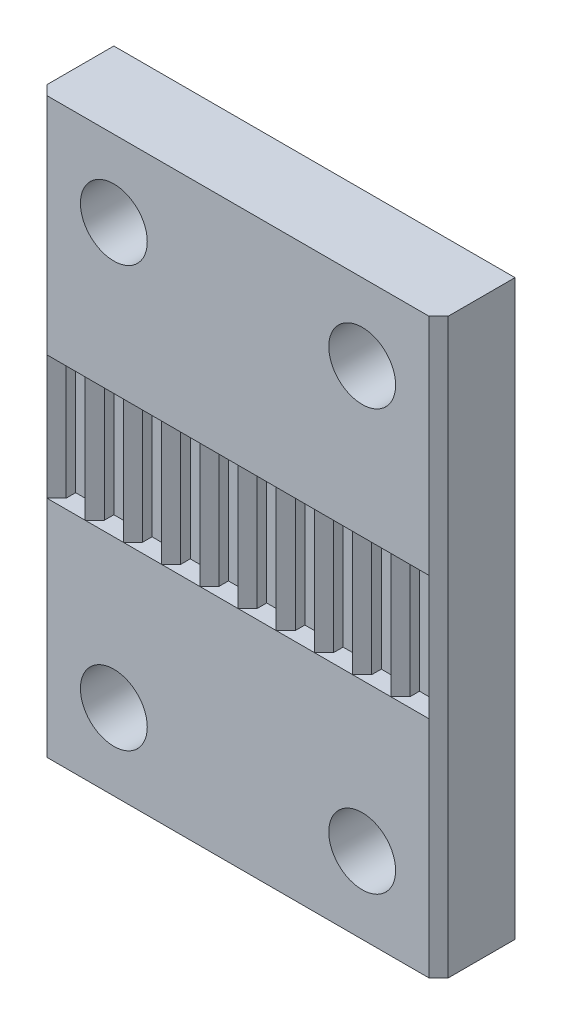
from build123d import *

# Parameters (mm, degrees)
SKETCH1_W           = 21
SKETCH1_H           = 30
SKETCH1_R           = 1.75
BOSS_EXTRUDE1_DEPTH = 4
SKETCH2_W           = 21
SKETCH2_H           = 6.5
CUT_EXTRUDE1_DEPTH  = 1
SKETCH3_W           = 1
SKETCH3_H           = 6.5
BOSS_EXTRUDE2_DEPTH = 1
CHAMFER1_SIZE       = 0.5
CHAMFER2_SIZE       = 0.5


with BuildPart() as part:
    # Sketch1 → Boss-Extrude1 (new body)
    with BuildSketch(Plane.XY):
        with Locations((10.5, 15)):
            Rectangle(SKETCH1_W, SKETCH1_H)
        with Locations((4, 4)):
            Circle(SKETCH1_R, mode=Mode.SUBTRACT)
        with Locations((17, 4)):
            Circle(SKETCH1_R, mode=Mode.SUBTRACT)
        with Locations((17, 26)):
            Circle(SKETCH1_R, mode=Mode.SUBTRACT)
        with Locations((4, 26)):
            Circle(SKETCH1_R, mode=Mode.SUBTRACT)
    extrude(amount=BOSS_EXTRUDE1_DEPTH)

    # Sketch2 → Cut-Extrude1 (cut)
    with BuildSketch(Plane.XY.offset(4)):
        with Locations((10.5, 15)):
            Rectangle(SKETCH2_W, SKETCH2_H)
    extrude(amount=-CUT_EXTRUDE1_DEPTH, mode=Mode.SUBTRACT)

    # Sketch3 → Boss-Extrude2 (add)
    with BuildSketch(Plane.XY.offset(3)):
        with Locations((0.5, 15)):
            Rectangle(SKETCH3_W, SKETCH3_H)
        with Locations((2.5, 15)):
            Rectangle(SKETCH3_W, SKETCH3_H)
        with Locations((4.5, 15)):
            Rectangle(SKETCH3_W, SKETCH3_H)
        with Locations((6.5, 15)):
            Rectangle(SKETCH3_W, SKETCH3_H)
        with Locations((8.5, 15)):
            Rectangle(SKETCH3_W, SKETCH3_H)
        with Locations((10.5, 15)):
            Rectangle(SKETCH3_W, SKETCH3_H)
        with Locations((12.5, 15)):
            Rectangle(SKETCH3_W, SKETCH3_H)
        with Locations((14.5, 15)):
            Rectangle(SKETCH3_W, SKETCH3_H)
        with Locations((16.5, 15)):
            Rectangle(SKETCH3_W, SKETCH3_H)
        with Locations((18.5, 15)):
            Rectangle(SKETCH3_W, SKETCH3_H)
        with Locations((20.5, 15)):
            Rectangle(SKETCH3_W, SKETCH3_H)
    extrude(amount=BOSS_EXTRUDE2_DEPTH)

    # Chamfer1
    chamfer1_edges = [part.edges().sort_by_distance(p)[0] for p in [
        (8, 15, 4),
        (9, 15, 4),
        (10, 15, 4),
        (11, 15, 4),
        (12, 15, 4),
        (13, 15, 4),
        (14, 15, 4),
        (15, 15, 4),
        (16, 15, 4),
        (17, 15, 4),
        (18, 15, 4),
        (19, 15, 4),
        (20, 15, 4),
        (1, 15, 4),
        (2, 15, 4),
        (3, 15, 4),
        (4, 15, 4),
        (5, 15, 4),
        (6, 15, 4),
        (7, 15, 4),
    ]]
    chamfer(chamfer1_edges, length=CHAMFER1_SIZE - 0.0001)  # a hair under: the kernel refuses the full size

    # Chamfer2
    chamfer2_edges = [part.edges().sort_by_distance(p)[0] for p in [
        (21, 15, 4),
        (0, 15, 4),
    ]]
    chamfer(chamfer2_edges, length=CHAMFER2_SIZE)


solid = part.part
